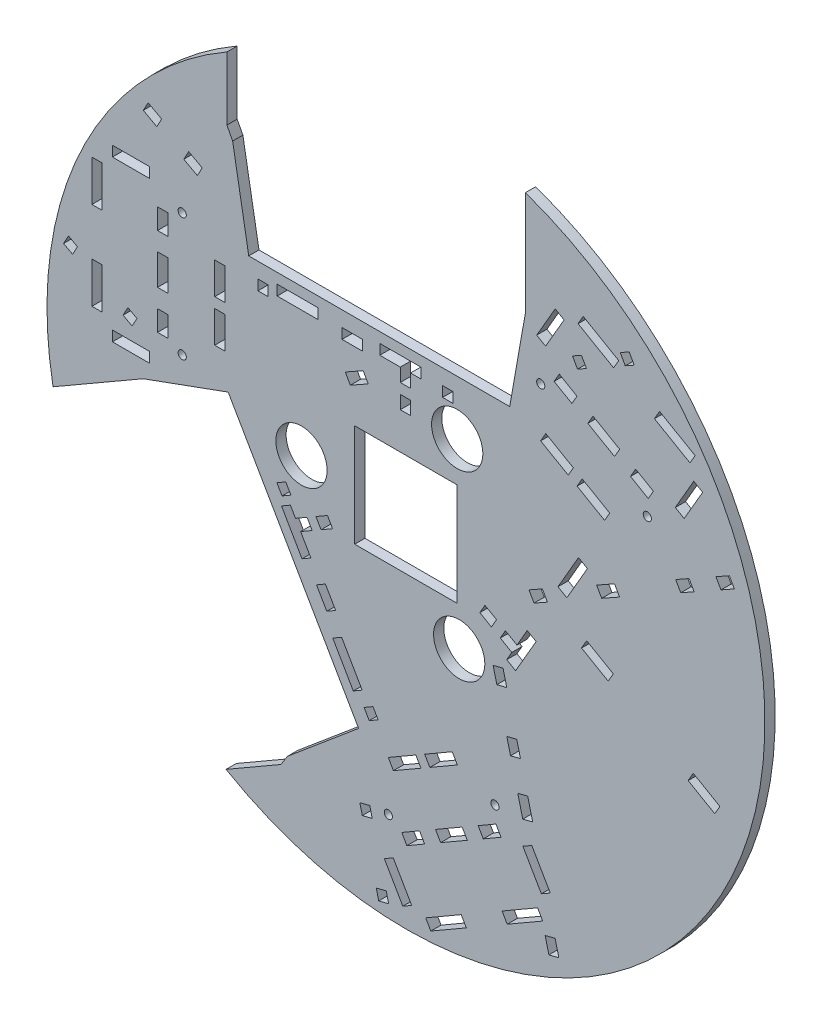
from build123d import *

# Parameters (mm, degrees)
ESQUISSE1_R                   = 175
BOSS_EXTRU_1_DEPTH            = 5
ESQUISSE2_W                   = 18
ESQUISSE2_H                   = 5
ESQUISSE2_W_2                 = 5
ESQUISSE2_H_2                 = 20
ESQUISSE2_H_3                 = 10
ESQUISSE2_H_4                 = 15
ESQUISSE2_H_5                 = 15.5
ESQUISSE2_W_3                 = 20
ESQUISSE2_H_6                 = 6.5
ENL_V_MAT_EXTRU_1_DEPTH       = 5
ESQUISSE6_R                   = 12.5
ESQUISSE6_W                   = 50
ESQUISSE6_H                   = 50
ENL_V_MAT_EXTRU_6_DEPTH       = 5
TROUS_DE_CENTRAGE_4_0MM1_D    = 4
HOLES_CATCHERS_OF_GLASS_DEPTH = 10
HOLES_BOARDS_SERVO_DEPTH      = 10
ESQUISSE11_W                  = 5
ESQUISSE11_H                  = 5
ESQUISSE11_W_2                = 10
ENL_V_MAT_EXTRU_7_DEPTH       = 5


with BuildPart() as part:
    # Esquisse1 → Boss.-Extru.1 (new body)
    with BuildSketch(Plane.XY):
        with Locations((148.080426897, -12.110171348)):
            Circle(ESQUISSE1_R)
    extrude(amount=BOSS_EXTRU_1_DEPTH)

    # Esquisse2 → Enlèv. mat.-Extru.1 (cut)
    with BuildSketch(Plane.XY.offset(5)):
        Polygon((135.311788567, 53.777441362), (135.311788567, 48.777441362), (145.311788567, 48.777441362), (145.311788567, 42.277441362), (150.311788567, 42.277441362), (150.311788567, 48.777441362), (155.311788567, 48.777441362), (155.311788567, 53.777441362), align=None)
        with Locations((14, 69.777441362)):
            Rectangle(ESQUISSE2_W, ESQUISSE2_H)
        with Locations((-2.5, 52.277441362)):
            Rectangle(ESQUISSE2_W_2, ESQUISSE2_H_2)
        with Locations((-2.5, 9.277441362)):
            Rectangle(ESQUISSE2_W_2, ESQUISSE2_H_2)
        with Locations((14, -8.222558638)):
            Rectangle(ESQUISSE2_W, ESQUISSE2_H)
        with Locations((29.5, 9.277441362)):
            Rectangle(ESQUISSE2_W_2, ESQUISSE2_H_3)
        with Locations((29.5, 30.777441362)):
            Rectangle(ESQUISSE2_W_2, ESQUISSE2_H_4)
        with Locations((29.5, 52.277441362)):
            Rectangle(ESQUISSE2_W_2, ESQUISSE2_H_3)
        with Locations((57.36, 41.027441362)):
            Rectangle(ESQUISSE2_W_2, ESQUISSE2_H_5)
        with Locations((57.36, 20.527441362)):
            Rectangle(ESQUISSE2_W_2, ESQUISSE2_H_5)
        with Locations((95.311788567, 51.277441362)):
            Rectangle(ESQUISSE2_W_3, ESQUISSE2_H)
        with Locations((147.811788567, 34.027441362)):
            Rectangle(ESQUISSE2_W_2, ESQUISSE2_H_6)
        Polygon((292.702456717, 69.607306773), (283.702456717, 54.018849505), (279.372329698, 56.518849505), (288.372329698, 72.107306773), align=None)
        Polygon((289.042202679, 83.267560811), (286.542202679, 78.937433792), (269.221694603, 88.937433792), (271.721694603, 93.267560811), align=None)
        Polygon((251.803110316, 104.767560811), (249.303110316, 100.437433792), (231.982602241, 110.437433792), (234.482602241, 114.767560811), align=None)
        Polygon((225.152475222, 108.607306773), (216.152475222, 93.018849505), (211.822348203, 95.518849505), (220.822348203, 111.107306773), align=None)
        Polygon((231.472983297, 79.55474789), (228.972983297, 75.224620871), (220.31272926, 80.224620871), (222.81272926, 84.55474789), align=None)
        Polygon((252.257592988, 67.55474789), (249.757592988, 63.224620871), (236.767211932, 70.724620871), (239.267211932, 75.05474789), align=None)
        Polygon((268.71207566, 58.05474789), (266.21207566, 53.724620871), (257.551821622, 58.724620871), (260.051821622, 63.05474789), align=None)
        Polygon((247.420859728, 38.17728014), (244.920859728, 33.847153121), (231.497465969, 41.597153121), (233.997465969, 45.92728014), align=None)
        Polygon((229.66733895, 48.42728014), (227.16733895, 44.097153121), (213.743945192, 51.847153121), (216.243945192, 56.17728014), align=None)
        Polygon((211.525092463, -33.996012539), (207.194965444, -31.496012539), (202.194965444, -40.156266577), (196.56580032, -36.906266577), (194.06580032, -41.236393596), (199.694965444, -44.486393596), (197.194965444, -48.816520615), (201.525092463, -51.316520615), align=None)
        Polygon((236.525092463, 9.30525765), (226.525092463, -8.015250425), (222.194965444, -5.515250425), (232.194965444, 11.80525765), align=None)
        Polygon((192.235673301, -34.406266577), (189.735673301, -38.736393596), (184.106508176, -35.486393596), (186.606508176, -31.156266577), align=None)
        Polygon((146.538823973, -178.215262181), (137.538823973, -162.626804912), (141.868950992, -160.126804912), (150.868950992, -175.715262181), align=None)
        Polygon((160.199078011, -181.875516218), (157.699078011, -177.545389199), (175.019586086, -167.545389199), (177.519586086, -171.875516218), align=None)
        Polygon((197.438170373, -160.375516218), (194.938170373, -156.045389199), (212.258678449, -146.045389199), (214.758678449, -150.375516218), align=None)
        Polygon((214.088805468, -139.215262181), (205.088805468, -123.626804912), (209.418932487, -121.126804912), (218.418932487, -136.715262181), align=None)
        Polygon((185.768297392, -130.162703297), (183.268297392, -125.832576278), (191.92855143, -120.832576278), (194.42855143, -125.162703297), align=None)
        Polygon((164.983687701, -142.162703297), (162.483687701, -137.832576278), (175.474068758, -130.332576278), (177.974068758, -134.662703297), align=None)
        Polygon((148.52920503, -151.662703297), (146.02920503, -147.332576278), (154.689459067, -142.332576278), (157.189459067, -146.662703297), align=None)
        Polygon((141.960420962, -123.285235548), (139.460420962, -118.955108529), (152.88381472, -111.205108529), (155.38381472, -115.535235548), align=None)
        Polygon((159.713941739, -113.035235548), (157.213941739, -108.705108529), (170.637335498, -100.955108529), (173.137335498, -105.285235548), align=None)
        Polygon((97.404399659, -56.111942869), (101.734526678, -53.611942869), (96.734526678, -44.951688831), (102.363691803, -41.701688831), (99.863691803, -37.371561812), (94.234526678, -40.621561812), (91.734526678, -36.291434793), (87.404399659, -38.791434793), align=None)
        Polygon((122.404399659, -99.413213058), (112.404399659, -82.092704982), (116.734526678, -79.592704982), (126.734526678, -96.913213058), align=None)
        Polygon((106.693818822, -39.201688831), (104.193818822, -34.871561812), (109.822983946, -31.621561812), (112.322983946, -35.951688831), align=None)
    extrude(amount=-ENL_V_MAT_EXTRU_1_DEPTH, mode=Mode.SUBTRACT)

    # Esquisse6 → Enlèv. mat.-Extru.6 (cut)
    with BuildSketch(Plane.XY.offset(5)):
        with Locations((173.06, 32.277441362)):
            Circle(ESQUISSE6_R)
        with Locations((174.031440566, -55.936922587)):
            Circle(ESQUISSE6_R)
        with Locations((97.149840124, -12.671032821)):
            Circle(ESQUISSE6_R)
        Polygon((206.321253746, 102.221853729), (206.321253746, 185.563712918), (60.797190046, 185.563712918), (60.797190046, 108.682370842), (63.584787187, 103.348250546), (71.443823398, 58.777441362), (198.660831685, 58.777441362), align=None)
        with Locations((148.080426897, -12.110171348)):
            Rectangle(ESQUISSE6_W, ESQUISSE6_H)
        Polygon((19.945575289, -18.838148298), (-52.230591968, -60.509077893), (20.531439882, -186.536613919), (87.112635197, -148.095942881), (90.338320311, -143.014752793), (125.008255225, -113.923223194), (61.399751081, -3.750062223), align=None)
        Polygon((236.171367804, -21.307411432), (249.16174886, -28.807411432), (246.66174886, -33.137538451), (233.671367804, -25.637538451), align=None)
        Polygon((288.132892031, -51.307411432), (301.123273088, -58.807411432), (298.623273088, -63.137538451), (285.632892031, -55.637538451), align=None)
    extrude(amount=-ENL_V_MAT_EXTRU_6_DEPTH, mode=Mode.SUBTRACT)

    # Trous de centrage Ø4.0mm1 (through all)
    with Locations(Plane(origin=(148.080426897, -12.110171348, -78), x_dir=(1, 0, 0), z_dir=(0, 0, -1))):
        with Locations((65.70121345, -88.022614393), (117.662737677, -58.022614393), (-109.080426897, -72.887612711), (-109.080426897, -12.887612711), (-8.58231078, 130.910227103), (43.379213447, 100.910227103)):
            Hole(TROUS_DE_CENTRAGE_4_0MM1_D / 2)

    # Esquisse9 → Holes catchers of glass (cut)
    with BuildSketch(Plane.XY.offset(5)):
        Polygon((301.647255965, 32.874727734), (299.200467122, 37.235143352), (305.741090548, 40.905326617), (308.187879391, 36.544910999), align=None)
        Polygon((282.025385687, 21.864177939), (279.578596844, 26.224593557), (286.11922027, 29.894776822), (288.566009113, 25.534361204), align=None)
        Polygon((252.208863696, 5.133035829), (249.762074852, 9.493451446), (241.041243617, 4.599873759), (243.488032461, 0.239458142), align=None)
        Polygon((214.608404145, -10.232560209), (217.055192988, -14.592975826), (210.514569562, -18.263159091), (208.067780719, -13.902743474), align=None)
        Polygon((259.347334993, 106.606466519), (254.986919375, 104.159677675), (252.540130532, 108.520093293), (256.900546149, 110.966882136), align=None)
        Polygon((236.069559733, 93.544454591), (231.709144116, 91.097665748), (229.262355272, 95.458081365), (233.62277089, 97.904870209), align=None)
        Polygon((129.675418669, 33.842806815), (120.954587434, 28.949229128), (118.507798591, 33.309644745), (127.228629826, 38.203222432), align=None)
        Polygon((-16.43844555, 23.279140051), (-12.045948181, 20.890423478), (-14.434664754, 16.49792611), (-18.827162123, 18.886642683), align=None)
        Polygon((12.552037084, 7.51361067), (16.944534453, 5.124894098), (14.55581788, 0.732396729), (10.163320511, 3.121113302), align=None)
        Polygon((22.412737241, 98.907081949), (29.001483294, 95.32400709), (26.612766722, 90.931509721), (20.024020668, 94.514584581), align=None)
        Polygon((42.178975401, 88.157857372), (48.767721454, 84.574782512), (46.379004881, 80.182285143), (39.790258828, 83.765360003), align=None)
        Polygon((126.799616111, -149.834276272), (125.585690653, -144.983875775), (130.43609115, -143.769950316), (131.650016608, -148.620350813), align=None)
        Polygon((134.811524138, -181.846919552), (133.597598679, -176.996519055), (138.447999176, -175.782593596), (139.661924635, -180.632994093), align=None)
        Polygon((190.561972498, -54.501375823), (195.412372995, -53.287450364), (197.233261183, -60.56305111), (192.382860686, -61.776976568), align=None)
        Polygon((202.088963017, -79.964653097), (197.23856252, -81.178578556), (199.059450708, -88.454179302), (203.909851205, -87.240253843), align=None)
        Polygon((222.604303267, -161.936421496), (217.75390277, -163.150346955), (215.933014582, -155.874746209), (220.783415079, -154.660820751), align=None)
    extrude(amount=-HOLES_CATCHERS_OF_GLASS_DEPTH, mode=Mode.SUBTRACT)

    # Esquisse10 → Holes boards servo (cut)
    with BuildSketch(Plane.XY.offset(5)):
        Polygon((89.496120404, -27.614401399), (91.996120404, -31.944528418), (87.66720686, -34.443827818), (85.16720686, -30.113700799), align=None)
    extrude(amount=-HOLES_BOARDS_SERVO_DEPTH, mode=Mode.SUBTRACT)

    # Esquisse11 → Enlèv. mat.-Extru.7 (cut)
    with BuildSketch(Plane.XY.offset(5)):
        Polygon((109.482860628, -72.232450944), (104.482860628, -63.572196906), (108.812987647, -61.072196906), (113.812987647, -69.732450944), align=None)
        Polygon((130.165993385, -108.056687739), (134.496120404, -105.556687739), (131.996120404, -101.22656072), (127.665993385, -103.72656072), align=None)
        Polygon((207.430235035, -101.306415284), (209.858085952, -111.007216278), (205.007685455, -112.221141737), (202.579834538, -102.520340743), align=None)
        with Locations((168.425291316, 48.777441362)):
            Rectangle(ESQUISSE11_W, ESQUISSE11_H)
        with Locations((121.925291316, 48.777441362)):
            Rectangle(ESQUISSE11_W_2, ESQUISSE11_H)
        with Locations((78.425291316, 48.777441362)):
            Rectangle(ESQUISSE11_W, ESQUISSE11_H)
    extrude(amount=-ENL_V_MAT_EXTRU_7_DEPTH, mode=Mode.SUBTRACT)


solid = part.part
